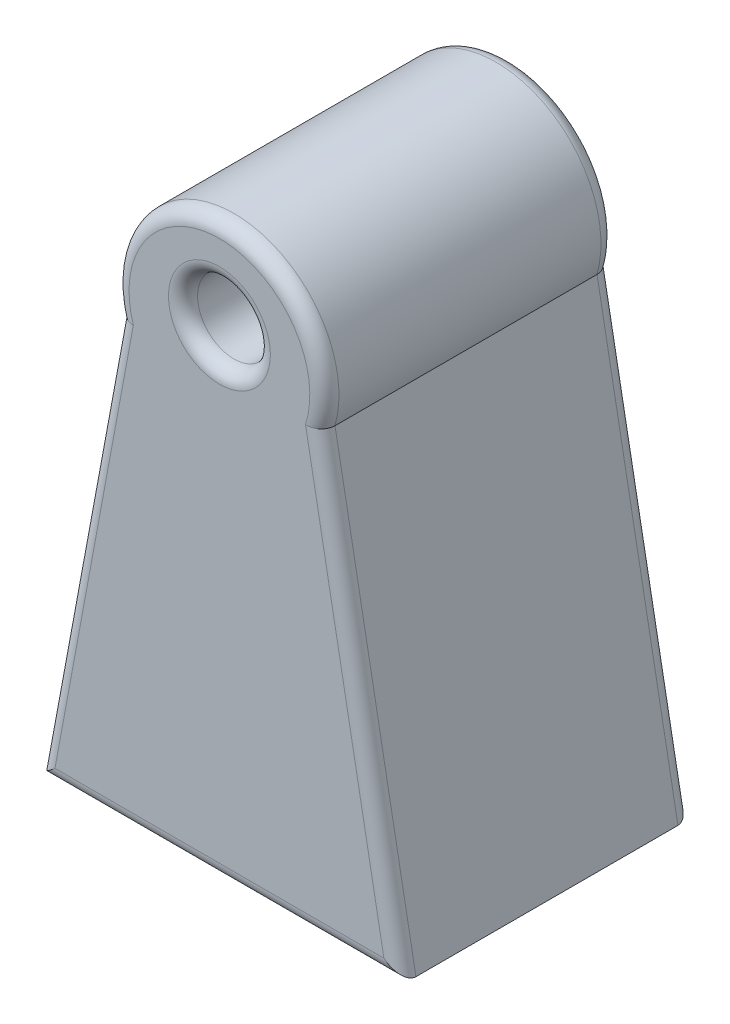
from build123d import *

# Parameters (mm, degrees)
BOSS_EXTRUDE1_DEPTH = 200
SKETCH3_R           = 25
CUT_EXTRUDE2_DEPTH  = 150
FILLET1_R           = 10
FILLET2_R           = 10
SHELL1_START        = 10
SHELL1_OUTLINE_R    = 35
SHELL1_DEPTH        = 180
SHELL1_2_OUTLINE_R  = 35
SHELL1_2_DEPTH      = 30
SKETCH4_W           = 226
SKETCH4_H           = 180
CUT_EXTRUDE4_DEPTH  = 10


# Read off the part's stored shape, not the designer's step: Shell1
with BuildPart() as part:
    # Sketch1 → Boss-Extrude1 (new body)
    with BuildSketch(Plane.XY):
        with BuildLine():
            Line((0, 0), (250, 0))
            Line((250, 0), (194.398287, 300))
            ThreePointArc((194.398287, 300), (125, 391.661115), (55.601713, 300))
            Line((55.601713, 300), (0, 0))
        make_face()
    extrude(amount=BOSS_EXTRUDE1_DEPTH)

    # Sketch3 → Cut-Extrude2 (cut)
    with BuildSketch(Plane.XY.offset(200)):
        with Locations((125, 330)):
            Circle(SKETCH3_R)
    extrude(amount=-CUT_EXTRUDE2_DEPTH, mode=Mode.SUBTRACT)

    # Fillet1
    fillet1_edges = [part.edges().sort_by_distance(p)[0] for p in [
        (222.199143, 150, 200),
        (125, 391.661115, 200),
        (100, 330, 200),
        (27.800857, 150, 200),
        (125, 0, 200),
    ]]
    fillet(fillet1_edges, radius=FILLET1_R)

    # Fillet2
    fillet2_edges = [part.edges().sort_by_distance(p)[0] for p in [
        (125, 391.661115, 0),
        (222.199143, 150, 0),
        (125, 0, 0),
        (27.800857, 150, 0),
    ]]
    fillet(fillet2_edges, radius=FILLET2_R)

    # Shell1 outline → Shell1 (cut)
    with BuildSketch(Plane.XY.offset(SHELL1_START)):
        with BuildLine():
            Line((65.875786, 300.559892), (12.023693, 10))
            Line((12.023693, 10), (237.976307, 10))
            Line((237.976307, 10), (184.124214, 300.559892))
            ThreePointArc((184.124214, 300.559892), (125, 381.661115), (65.875786, 300.559892))
        make_face()
        with Locations((125, 330)):
            Circle(SHELL1_OUTLINE_R, mode=Mode.SUBTRACT)
    extrude(amount=SHELL1_DEPTH, mode=Mode.SUBTRACT)

    # Shell1 2 outline → Shell1 2 (cut)
    with BuildSketch(Plane.XY.offset(SHELL1_START)):
        with Locations((125, 330)):
            Circle(SHELL1_2_OUTLINE_R)
    extrude(amount=SHELL1_2_DEPTH, mode=Mode.SUBTRACT)

    # Sketch4 → Cut-Extrude4 (cut)
    with BuildSketch(Plane.XZ):
        with Locations((125, 100)):
            Rectangle(SKETCH4_W, SKETCH4_H)
    extrude(amount=-CUT_EXTRUDE4_DEPTH, mode=Mode.SUBTRACT)


solid = part.part
